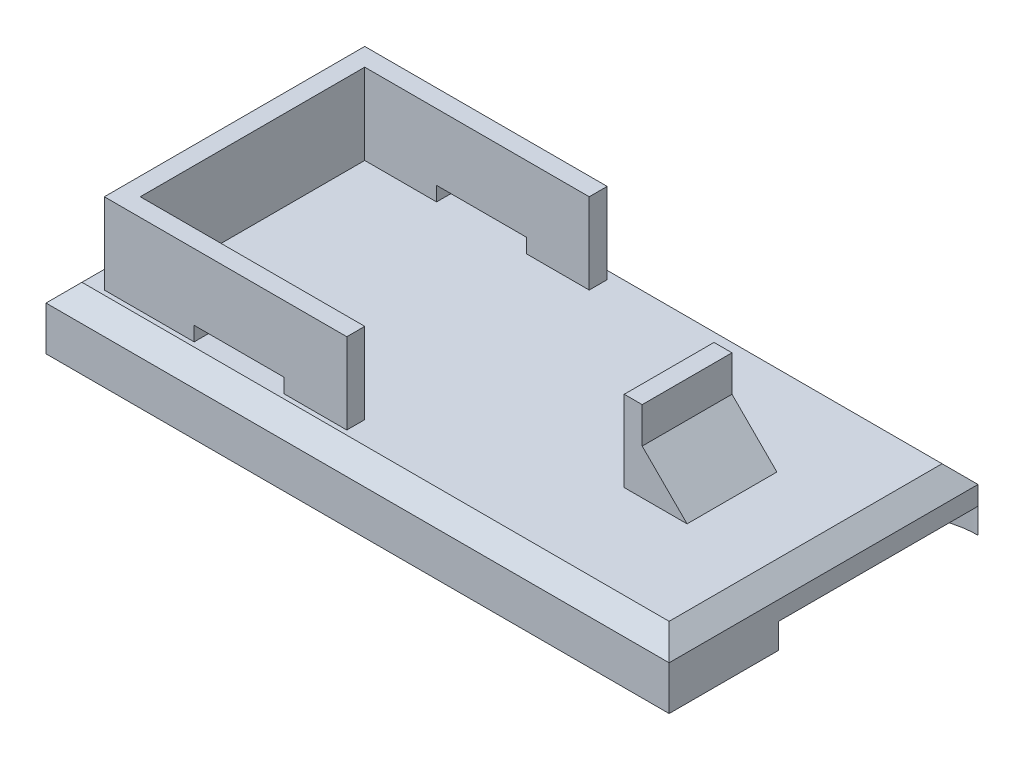
from build123d import *

# Parameters (mm, degrees)
SKETCH1_W           = 88.138
SKETCH1_H           = 43.688
BOSS_EXTRUDE1_DEPTH = 8.763
CHAMFER1_SIZE       = 2.54
SKETCH2_W           = 2.54
SKETCH2_H           = 12.7
BOSS_EXTRUDE2_DEPTH = 11.43
SKETCH3_W           = 20.32
SKETCH3_H           = 3.81
BOSS_EXTRUDE3_DEPTH = 7.62
CHAMFER2_SIZE       = 2.54
SKETCH4_W           = 12.7
SKETCH4_H           = 2.032
CUT_EXTRUDE1_DEPTH  = 50.8
CUT_EXTRUDE2_DEPTH  = 3.556
CHAMFER3_SIZE       = 6.35


with BuildPart() as part:
    # Sketch1 → Boss-Extrude1 (new body)
    with BuildSketch(Plane(origin=(0, 0, 0), x_dir=(1, 0, 0), z_dir=(0, 1, 0))):
        with Locations((1.121860858, 10.456938882)):
            Rectangle(SKETCH1_W, SKETCH1_H)
    extrude(amount=BOSS_EXTRUDE1_DEPTH)

    # Chamfer1
    chamfer1_edges = [part.edges().sort_by_distance(p)[0] for p in [
        (45.190860858, 8.763, -10.456938882),
        (1.121860858, 8.763, -32.300938882),
        (-42.947139142, 8.763, -10.456938882),
        (1.121860858, 8.763, 11.387061118),
    ]]
    chamfer(chamfer1_edges, length=CHAMFER1_SIZE)

    # Sketch2 → Boss-Extrude2 (add)
    with BuildSketch(Plane(origin=(0, 8.763, 0), x_dir=(1, 0, 0), z_dir=(0, 1, 0))):
        Polygon((-37.867139142, 28.617938882), (-35.327139142, 28.617938882), (-3.577139142, 28.617938882), (-3.577139142, 26.077938882), (-35.327139142, 26.077938882), (-35.327139142, -5.672061118), (-3.577139142, -5.672061118), (-3.577139142, -8.212061118), (-35.327139142, -8.212061118), (-37.867139142, -8.212061118), align=None)
        with Locations((24.362860858, 10.710938882)):
            Rectangle(SKETCH2_W, SKETCH2_H)
    extrude(amount=BOSS_EXTRUDE2_DEPTH)

    # Sketch3 → Boss-Extrude3 (add)
    with BuildSketch(Plane.ZY.offset(37.867139142)):
        with Locations((-9.567938882, 5.9055)):
            Rectangle(SKETCH3_W, SKETCH3_H)
    extrude(amount=BOSS_EXTRUDE3_DEPTH)

    # Chamfer2
    chamfer2_edges = [part.edges().sort_by_distance(p)[0] for p in [
        (-45.487139142, 4.0005, -9.567938882),
    ]]
    chamfer(chamfer2_edges, length=CHAMFER2_SIZE - 0.0001)  # a hair under: the kernel refuses the full size

    # Sketch4 → Cut-Extrude1 (cut)
    with BuildSketch(Plane.XY.offset(8.212061118)):
        with Locations((-18.817139142, 9.779)):
            Rectangle(SKETCH4_W, SKETCH4_H)
    extrude(amount=-CUT_EXTRUDE1_DEPTH, mode=Mode.SUBTRACT)

    # Sketch5 → Cut-Extrude2 (cut)
    with BuildSketch(Plane.XZ):
        with BuildLine():
            Line((35.030860858, -4.106938882), (45.190860858, -4.106938882))
            Line((45.190860858, -4.106938882), (45.190860858, -16.806938882))
            Line((45.190860858, -16.806938882), (45.190860858, -32.300938882))
            add(Edge.make_bspline(
                [(28.680860858, -10.456938882), (28.680860858, -32.300938882), (45.190860858, -32.300938882)],
                knots=[4.71238898, 4.71238898, 4.71238898, 6.283185307, 6.283185307, 6.283185307], degree=2, weights=[1, 0.707106781, 1]))
            ThreePointArc((28.680860858, -10.456938882), (30.540732798, -5.966810821), (35.030860858, -4.106938882))
        make_face()
    extrude(amount=-CUT_EXTRUDE2_DEPTH, mode=Mode.SUBTRACT)

    # Chamfer3
    chamfer3_edges = [part.edges().sort_by_distance(p)[0] for p in [
        (25.632860858, 8.763, -10.710938882),
    ]]
    chamfer(chamfer3_edges, length=CHAMFER3_SIZE)


solid = part.part
